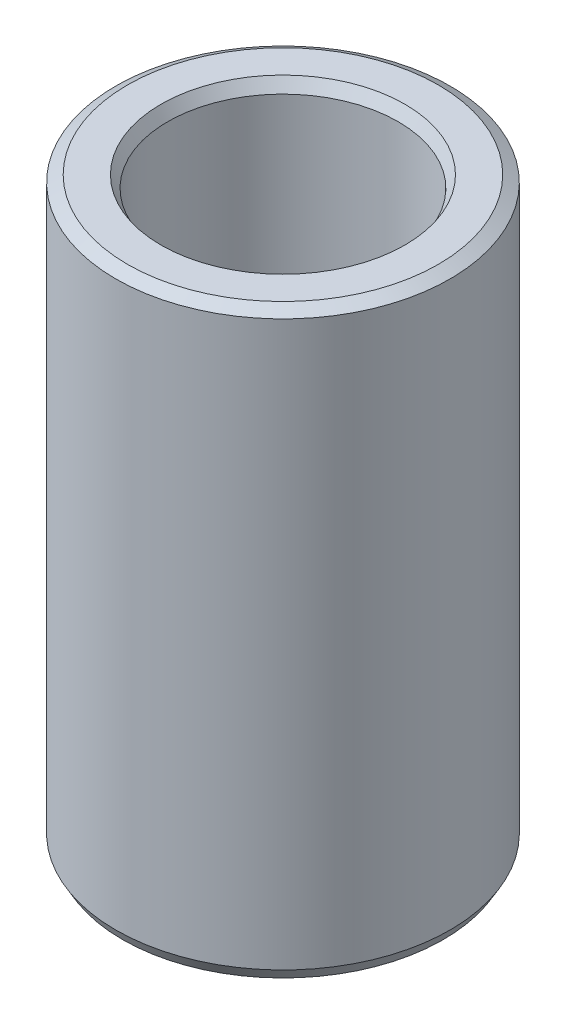
from build123d import *
from OCP.BRepFilletAPI import BRepFilletAPI_MakeChamfer

# Parameters (mm, degrees)
SKETCH1_R           = 37.5
BOSS_EXTRUDE1_DEPTH = 130.658322625
SKETCH2_R           = 25.855231511
CUT_EXTRUDE1_DEPTH  = 142.010982803
CHAMFER1_SIZE       = 1.518095303
CHAMFER1_SIZE2      = 2.629418196


with BuildPart() as part:
    # Sketch1 → Boss-Extrude1 (new body)
    with BuildSketch(Plane(origin=(0, 0, 0), x_dir=(1, 0, 0), z_dir=(0, 1, 0))):
        Circle(SKETCH1_R)
    extrude(amount=BOSS_EXTRUDE1_DEPTH)

    # Sketch2 → Cut-Extrude1 (cut, through all)
    with BuildSketch(Plane(origin=(0, 0, 0), x_dir=(1, 0, 0), z_dir=(0, 1, 0))):
        Circle(SKETCH2_R)
    extrude(amount=CUT_EXTRUDE1_DEPTH, mode=Mode.SUBTRACT)

    # Chamfer1: one chamfer whose edges measure the first distance from different faces: ONE call of the kernel's chamfer builder (chamfer() names one face for all edges)
    chamfer1_edges_1 = [part.edges().sort_by_distance(p)[0] for p in [
        (-25.855231511, 130.658322625, 0),
    ]]
    chamfer1_side_1 = [part.faces().sort_by_distance(p)[0] for p in [
        (-36.439339828, 130.658322625, 0),
    ]]
    chamfer1_edges_2 = [part.edges().sort_by_distance(p)[0] for p in [
        (-25.855231511, 0, 0),
    ]]
    chamfer1_side_2 = [part.faces().sort_by_distance(p)[0] for p in [
        (-25.855231511, 65.329161312, 0),
    ]]
    chamfer1_edges_3 = [part.edges().sort_by_distance(p)[0] for p in [
        (-37.5, 0, 0),
    ]]
    chamfer1_side_3 = [part.faces().sort_by_distance(p)[0] for p in [
        (-36.439339828, 0, 0),
    ]]
    chamfer1_edges_4 = [part.edges().sort_by_distance(p)[0] for p in [
        (-37.5, 130.658322625, 0),
    ]]
    chamfer1_side_4 = [part.faces().sort_by_distance(p)[0] for p in [
        (-37.5, 65.329161312, 0),
    ]]
    chamfer1 = BRepFilletAPI_MakeChamfer(part.part.solid().wrapped)
    for e in chamfer1_edges_1:
        chamfer1.Add(CHAMFER1_SIZE, CHAMFER1_SIZE2, e.wrapped, chamfer1_side_1[0].wrapped)  # the first distance lies on this face
    for e in chamfer1_edges_2:
        chamfer1.Add(CHAMFER1_SIZE, CHAMFER1_SIZE2, e.wrapped, chamfer1_side_2[0].wrapped)  # the first distance lies on this face
    for e in chamfer1_edges_3:
        chamfer1.Add(CHAMFER1_SIZE, CHAMFER1_SIZE2, e.wrapped, chamfer1_side_3[0].wrapped)  # the first distance lies on this face
    for e in chamfer1_edges_4:
        chamfer1.Add(CHAMFER1_SIZE, CHAMFER1_SIZE2, e.wrapped, chamfer1_side_4[0].wrapped)  # the first distance lies on this face
    add(Compound.cast(chamfer1.Shape()), mode=Mode.REPLACE)


solid = part.part
